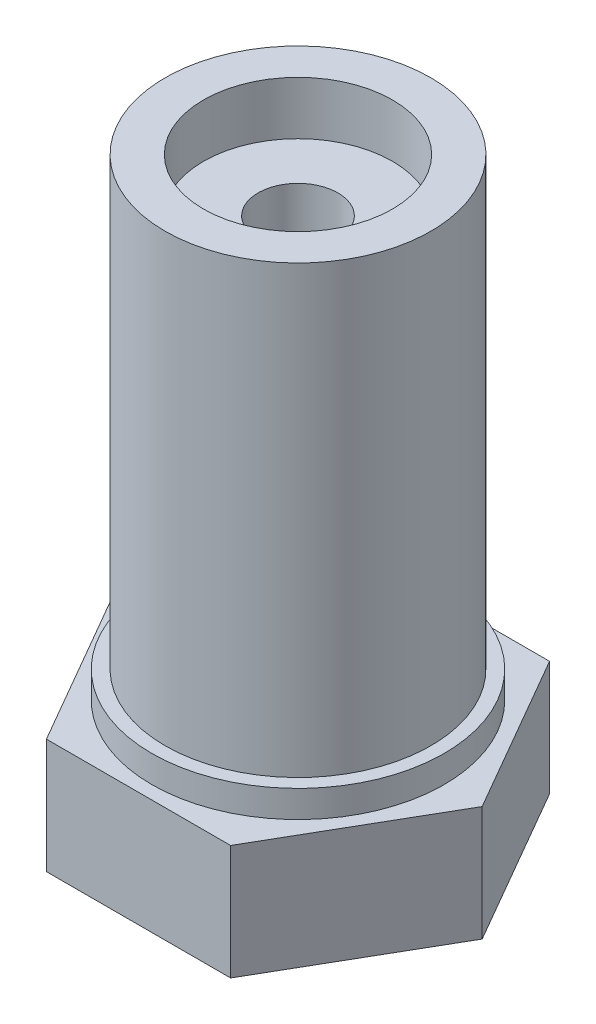
from build123d import *

# Parameters (mm, degrees)
BOSS_EXTRUDE1_DEPTH = 4.318
SKETCH2_R           = 5.500000049
SKETCH2_R_2         = 5.000000033
BOSS_EXTRUDE2_DEPTH = 1.016
SKETCH2_2_R         = 5.000000033
BOSS_EXTRUDE3_DEPTH = 17.78
SKETCH4_R           = 1.5
CUT_EXTRUDE2_DEPTH  = 24.923244011
SKETCH4_3_R         = 3.556
SKETCH4_3_R_2       = 1.5
CUT_EXTRUDE3_DEPTH  = 2


with BuildPart() as part:
    # Sketch1 → Boss-Extrude1 (new body)
    with BuildSketch(Plane(origin=(0, 0, 0), x_dir=(1, 0, 0), z_dir=(0, 1, 0))):
        Polygon((3.464101615, 6), (-3.464101615, 6), (-6.92820323, 0), (-3.464101615, -6), (3.464101615, -6), (6.92820323, 0), align=None)
    extrude(amount=BOSS_EXTRUDE1_DEPTH)

    # Sketch2 → Boss-Extrude2 (add)
    with BuildSketch(Plane(origin=(0, 4.318, 0), x_dir=(1, 0, 0), z_dir=(0, 1, 0))):
        Circle(SKETCH2_R)
        Circle(SKETCH2_R_2, mode=Mode.SUBTRACT)
    extrude(amount=BOSS_EXTRUDE2_DEPTH)

    # Sketch2<2> → Boss-Extrude3 (add)
    with BuildSketch(Plane(origin=(0, 4.318, 0), x_dir=(1, 0, 0), z_dir=(0, 1, 0))):
        Circle(SKETCH2_2_R)
    extrude(amount=BOSS_EXTRUDE3_DEPTH)

    # Sketch4 → Cut-Extrude2 (cut, through all)
    with BuildSketch(Plane(origin=(0, 22.098, 0), x_dir=(1, 0, 0), z_dir=(0, 1, 0))):
        Circle(SKETCH4_R)
    extrude(amount=-CUT_EXTRUDE2_DEPTH, mode=Mode.SUBTRACT)

    # Sketch4<3> → Cut-Extrude3 (cut)
    with BuildSketch(Plane(origin=(0, 22.098, 0), x_dir=(1, 0, 0), z_dir=(0, 1, 0))):
        Circle(SKETCH4_3_R)
        Circle(SKETCH4_3_R_2, mode=Mode.SUBTRACT)
    extrude(amount=-CUT_EXTRUDE3_DEPTH, mode=Mode.SUBTRACT)


solid = part.part
